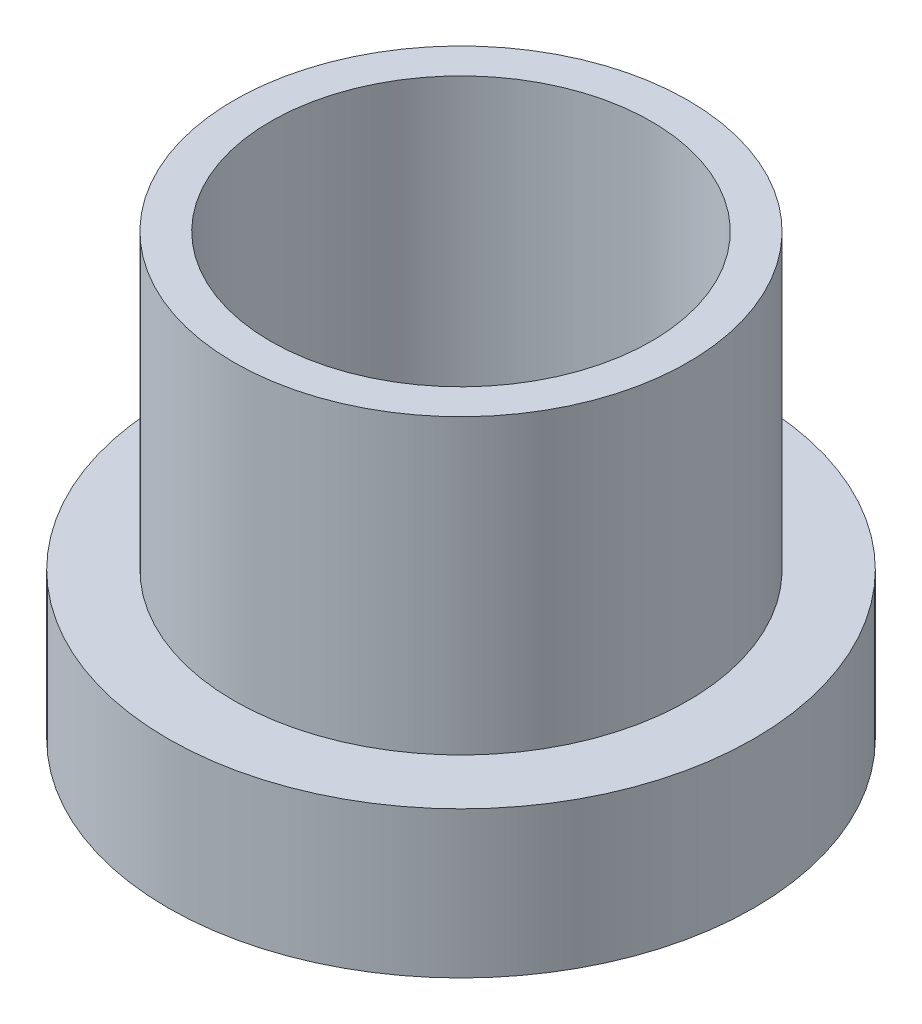
from build123d import *

# Parameters (mm, degrees)
SKETCH1_R           = 3.1
SKETCH1_R_2         = 2.6
BOSS_EXTRUDE1_DEPTH = 6
SKETCH2_R           = 4
SKETCH2_R_2         = 2.6
BOSS_EXTRUDE2_DEPTH = 2


with BuildPart() as part:
    # Sketch1 → Boss-Extrude1 (new body)
    with BuildSketch(Plane(origin=(0, 0, 0), x_dir=(1, 0, 0), z_dir=(0, 1, 0))):
        Circle(SKETCH1_R)
        Circle(SKETCH1_R_2, mode=Mode.SUBTRACT)
    extrude(amount=BOSS_EXTRUDE1_DEPTH)

    # Sketch2 → Boss-Extrude2 (add)
    with BuildSketch(Plane.XZ):
        Circle(SKETCH2_R)
        Circle(SKETCH2_R_2, mode=Mode.SUBTRACT)
    extrude(amount=-BOSS_EXTRUDE2_DEPTH)


solid = part.part
